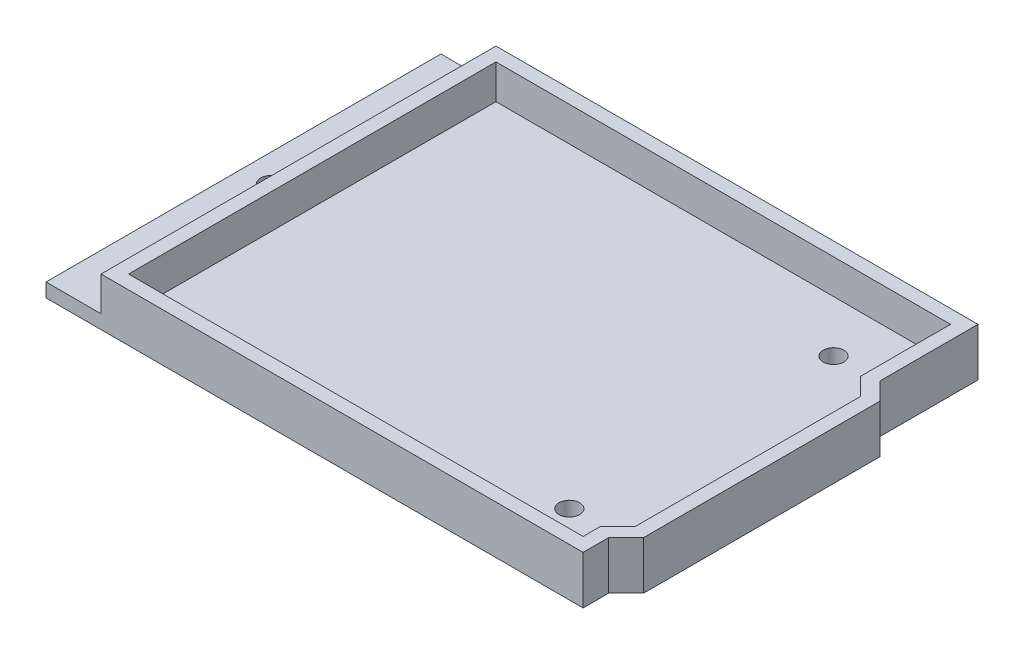
from build123d import *

# Parameters (mm, degrees)
BOSS_EXTRUDE1_DEPTH = 7
BOSS_EXTRUDE2_DEPTH = 2
SKETCH3_W           = 8
SKETCH3_H           = 57.4
BOSS_EXTRUDE3_DEPTH = 2
SKETCH4_R           = 1.5
CUT_EXTRUDE1_DEPTH  = 61.043728125
SKETCH5_R           = 3
SKETCH5_R_2         = 1.5
BOSS_EXTRUDE4_DEPTH = 1
FILLET1_R           = 0.5
FILLET2_R           = 0.5
FILLET3_R           = 0.5


with BuildPart() as part:
    # Sketch1 → Boss-Extrude1 (new body)
    with BuildSketch(Plane(origin=(0, 0, 0), x_dir=(1, 0, 0), z_dir=(0, 1, 0))):
        Polygon((40.466684636, -3.437606291), (37.926684636, -0.897606291), (37.926684636, 13.323966584), (-32.133315364, 13.323966584), (-32.133315364, -44.076033416), (37.926684636, -44.076033416), (37.926684636, -40.364460541), (40.466684636, -37.824460541), align=None)
        Polygon((35.926684636, 11.323966584), (35.926684636, -1.726033416), (38.466684636, -4.266033416), (38.466684636, -36.996033416), (35.926684636, -39.536033416), (35.926684636, -42.076033416), (-30.133315364, -42.076033416), (-30.133315364, 11.323966584), align=None, mode=Mode.SUBTRACT)
    extrude(amount=BOSS_EXTRUDE1_DEPTH)

    # Sketch2 → Boss-Extrude2 (add)
    with BuildSketch(Plane(origin=(0, 0, 0), x_dir=(1, 0, 0), z_dir=(0, 1, 0))):
        Polygon((-30.133315364, 11.323966584), (35.926684636, 11.323966584), (35.926684636, -1.726033416), (38.466684636, -4.266033416), (38.466684636, -36.996033416), (35.926684636, -39.536033416), (35.926684636, -42.076033416), (-30.133315364, -42.076033416), align=None)
    extrude(amount=BOSS_EXTRUDE2_DEPTH)

    # Sketch3 → Boss-Extrude3 (add)
    with BuildSketch(Plane(origin=(0, 0, 0), x_dir=(1, 0, 0), z_dir=(0, 1, 0))):
        with Locations((-36.133315364, -15.376033416)):
            Rectangle(SKETCH3_W, SKETCH3_H)
    extrude(amount=BOSS_EXTRUDE3_DEPTH)

    # Sketch4 → Cut-Extrude1 (cut, through all)
    with BuildSketch(Plane(origin=(0, 2, 0), x_dir=(1, 0, 0), z_dir=(0, 1, 0))):
        with Locations((-36.133315364, -15.376033416)):
            Circle(SKETCH4_R)
        with Locations((26.426684636, 3.823966584)):
            Circle(SKETCH4_R)
        with Locations((26.426684636, -34.576033416)):
            Circle(SKETCH4_R)
    extrude(amount=-CUT_EXTRUDE1_DEPTH, mode=Mode.SUBTRACT)

    # Sketch5 → Boss-Extrude4 (add)
    # profile 1 of 3: a face of its own
    with BuildSketch(Plane.XZ):
        with Locations((26.426684636, 34.576033416)):
            Circle(SKETCH5_R)
        with Locations((26.426684636, 34.576033416)):
            Circle(SKETCH5_R_2, mode=Mode.SUBTRACT)
    # profile 2 of 3: a face of its own
    with BuildSketch(Plane.XZ):
        with Locations((26.426684636, -3.823966584)):
            Circle(SKETCH5_R)
        with Locations((26.426684636, -3.823966584)):
            Circle(SKETCH5_R_2, mode=Mode.SUBTRACT)
    # profile 3 of 3: a face of its own
    with BuildSketch(Plane.XZ):
        with Locations((-36.133315364, 15.376033416)):
            Circle(SKETCH5_R)
        with Locations((-36.133315364, 15.376033416)):
            Circle(SKETCH5_R_2, mode=Mode.SUBTRACT)
    extrude(amount=BOSS_EXTRUDE4_DEPTH)

    # Fillet1
    fillet1_edges = [part.edges().sort_by_distance(p)[0] for p in [
        (-39.133315364, -1, 15.376033416),
    ]]
    fillet(fillet1_edges, radius=FILLET1_R)

    # Fillet2
    fillet2_edges = [part.edges().sort_by_distance(p)[0] for p in [
        (23.426684636, -1, -3.823966584),
    ]]
    fillet(fillet2_edges, radius=FILLET2_R)

    # Fillet3
    fillet3_edges = [part.edges().sort_by_distance(p)[0] for p in [
        (23.426684636, -1, 34.576033416),
    ]]
    fillet(fillet3_edges, radius=FILLET3_R)


solid = part.part
